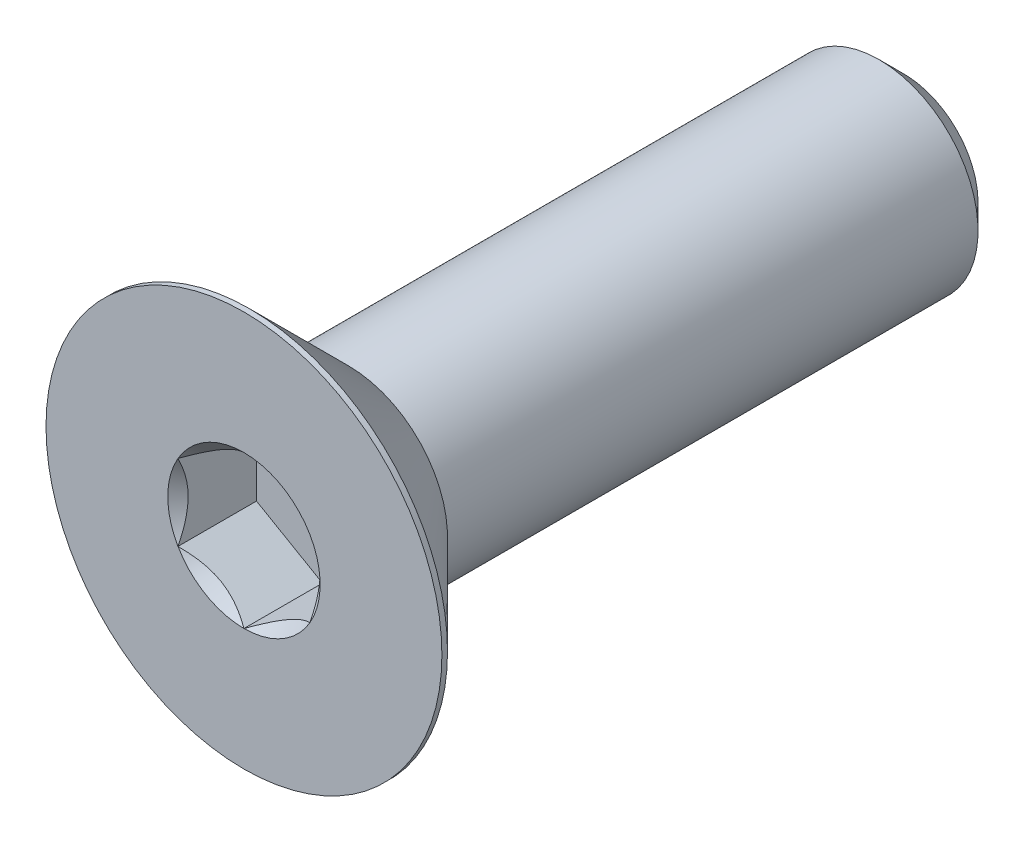
from build123d import *

# Parameters (mm, degrees)
CHAMFER1_SIZE      = 0.375
CUT_EXTRUDE2_DEPTH = 1.19


with BuildPart() as part:
    # Sketch1 → Revolve1 (revolve)
    with BuildSketch(Plane(origin=(0, 0, 0), x_dir=(0, 0, -1), z_dir=(1, 0, 0))):
        Polygon((-3.3, 1.5), (5, 1.5), (5, 0), (-3.81, 0), (-3.81, 1.5), align=None)
    revolve(axis=Axis((0, 0, 3.81), (0, 0, -1)))

    # Chamfer1
    chamfer1_edges = [part.edges().sort_by_distance(p)[0] for p in [
        (0, -1.5, -5),
    ]]
    chamfer(chamfer1_edges, length=CHAMFER1_SIZE)


with BuildPart() as body_2:
    # Sketch7 → Revolve2 (revolve)
    with BuildSketch(Plane(origin=(0, 0, 0), x_dir=(0, 0, -1), z_dir=(1, 0, 0))):
        Polygon((-4.915, 3), (-5, 3), (-5, 0), (-3.3, 0), (-3.3, 1.385), align=None)
    revolve(axis=Axis((0, 0, 5), (0, 0, -1)))

    # Sketch5 → Cut-Extrude2 (cut)
    with BuildSketch(Plane.XY.offset(5)):
        Polygon((1, -0.577350269), (1, 0.577350269), (0, 1.154700538), (-1, 0.577350269), (-1, -0.577350269), (0, -1.154700538), align=None)
    extrude(amount=-CUT_EXTRUDE2_DEPTH, mode=Mode.SUBTRACT)

    # Cut-Extrude3 cone 1 section (through the dimple's axis) → Cut-Extrude3 (revolve, cut)
    with BuildSketch(Plane(origin=(0, 0, 5), x_dir=(0, -1, 0), z_dir=(1, 0, 0))):
        Polygon((0, 0), (1.154700538, 0), (0, 1.154700538), align=None)
    revolve(axis=Axis((0, 0, 5), (0, 0, -1)), mode=Mode.SUBTRACT)

    # Combine1: union part
    add(part.part)


solid = body_2.part
